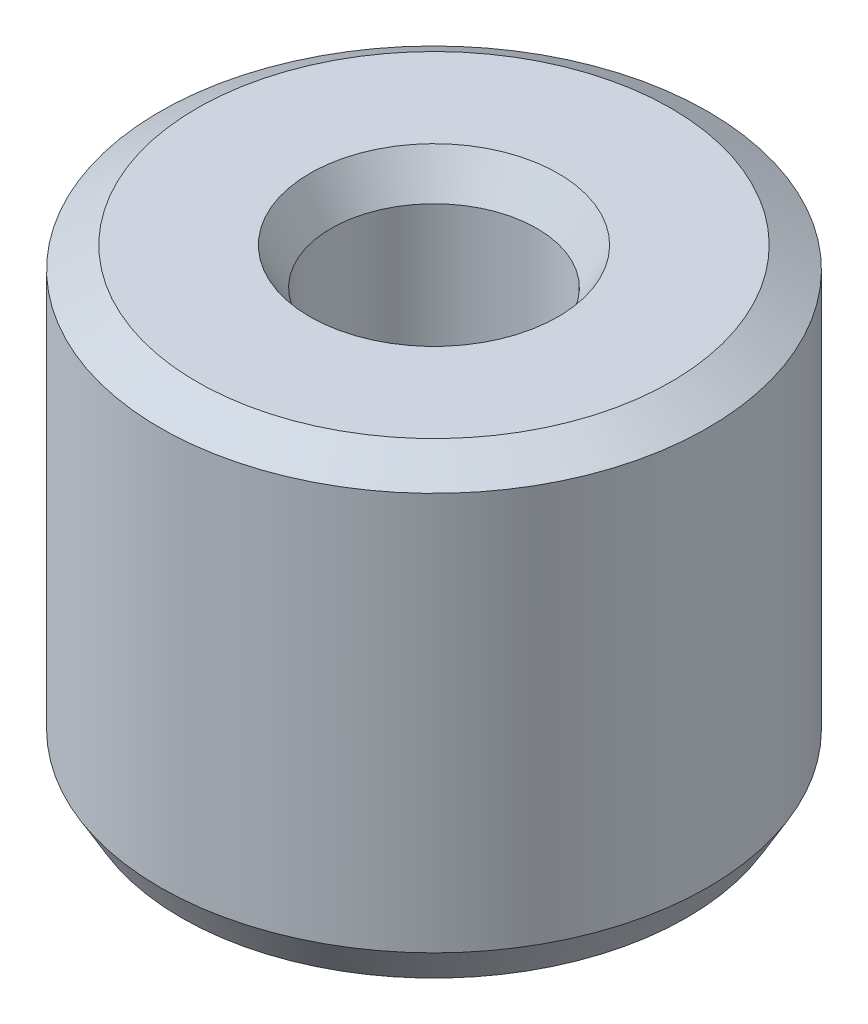
from build123d import *
from OCP.BRepFilletAPI import BRepFilletAPI_MakeChamfer

# Parameters (mm, degrees)
SKETCH1_R           = 22.5
BOSS_EXTRUDE1_DEPTH = 37.468130334
SKETCH2_R           = 8.447673001
CUT_EXTRUDE1_DEPTH  = 50.156492864
CHAMFER1_SIZE       = 1.751507614
CHAMFER1_SIZE2      = 3.033700178


with BuildPart() as part:
    # Sketch1 → Boss-Extrude1 (new body)
    with BuildSketch(Plane(origin=(0, 0, 0), x_dir=(1, 0, 0), z_dir=(0, 1, 0))):
        Circle(SKETCH1_R)
    extrude(amount=BOSS_EXTRUDE1_DEPTH)

    # Sketch2 → Cut-Extrude1 (cut, through all)
    with BuildSketch(Plane(origin=(0, 0, 0), x_dir=(1, 0, 0), z_dir=(0, 1, 0))):
        Circle(SKETCH2_R)
    extrude(amount=CUT_EXTRUDE1_DEPTH, mode=Mode.SUBTRACT)

    # Chamfer1: one chamfer whose edges measure the first distance from different faces: ONE call of the kernel's chamfer builder (chamfer() names one face for all edges)
    chamfer1_edges_1 = [part.edges().sort_by_distance(p)[0] for p in [
        (-8.447673001, 37.468130334, 0),
    ]]
    chamfer1_side_1 = [part.faces().sort_by_distance(p)[0] for p in [
        (-21.863603897, 37.468130334, 0),
    ]]
    chamfer1_edges_2 = [part.edges().sort_by_distance(p)[0] for p in [
        (-8.447673001, 0, 0),
    ]]
    chamfer1_side_2 = [part.faces().sort_by_distance(p)[0] for p in [
        (-8.447673001, 18.734065167, 0),
    ]]
    chamfer1_edges_3 = [part.edges().sort_by_distance(p)[0] for p in [
        (-22.5, 0, 0),
    ]]
    chamfer1_side_3 = [part.faces().sort_by_distance(p)[0] for p in [
        (-21.863603897, 0, 0),
    ]]
    chamfer1_edges_4 = [part.edges().sort_by_distance(p)[0] for p in [
        (-22.5, 37.468130334, 0),
    ]]
    chamfer1_side_4 = [part.faces().sort_by_distance(p)[0] for p in [
        (-22.5, 18.734065167, 0),
    ]]
    chamfer1 = BRepFilletAPI_MakeChamfer(part.part.solid().wrapped)
    for e in chamfer1_edges_1:
        chamfer1.Add(CHAMFER1_SIZE, CHAMFER1_SIZE2, e.wrapped, chamfer1_side_1[0].wrapped)  # the first distance lies on this face
    for e in chamfer1_edges_2:
        chamfer1.Add(CHAMFER1_SIZE, CHAMFER1_SIZE2, e.wrapped, chamfer1_side_2[0].wrapped)  # the first distance lies on this face
    for e in chamfer1_edges_3:
        chamfer1.Add(CHAMFER1_SIZE, CHAMFER1_SIZE2, e.wrapped, chamfer1_side_3[0].wrapped)  # the first distance lies on this face
    for e in chamfer1_edges_4:
        chamfer1.Add(CHAMFER1_SIZE, CHAMFER1_SIZE2, e.wrapped, chamfer1_side_4[0].wrapped)  # the first distance lies on this face
    add(Compound.cast(chamfer1.Shape()), mode=Mode.REPLACE)


solid = part.part
